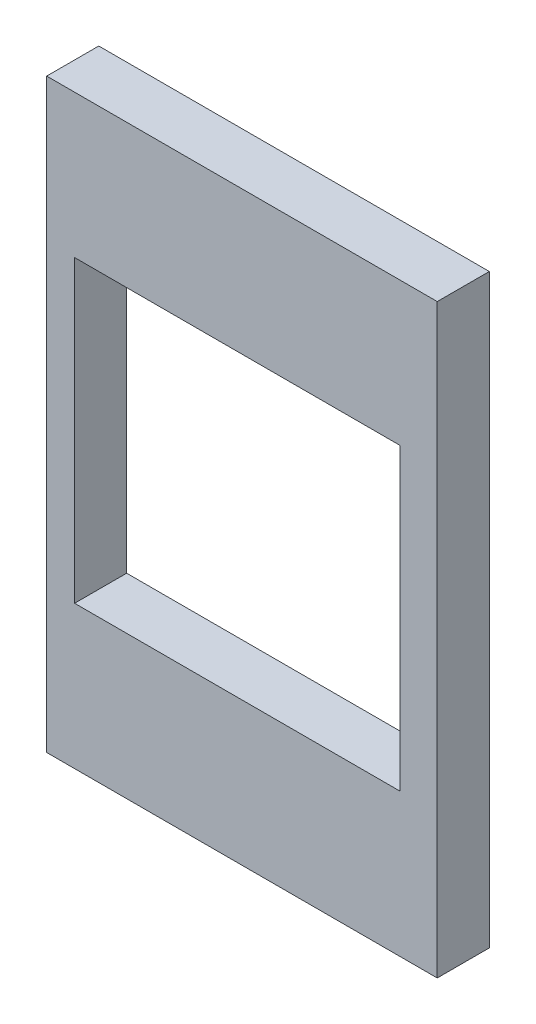
from build123d import *

# Parameters (mm, degrees)
SKETCH_1_W          = 60
SKETCH_1_H          = 90
EXTRUDE_1_DEPTH     = 8
CUT_EXTRUDE_1_REACH = 98.762


with BuildPart() as part:
    # 草图1 → 凸台-拉伸1 (new body)
    with BuildSketch(Plane.XY):
        with Locations((-55.287083442, 0)):
            Rectangle(SKETCH_1_W, SKETCH_1_H)
    extrude(amount=EXTRUDE_1_DEPTH)

    # 草图2 → 切除-拉伸1 (cut, up to next)
    with BuildSketch(Plane.XY.offset(8), mode=Mode.PRIVATE) as cut_extrude_1_sk1:
        Polygon((-81, 17), (-81, 23), (-31, 23), (-31, 17), (-31, -17), (-31, -23), (-81, -23), (-81, -17), align=None)
    cut_extrude_1_tool1 = extrude(cut_extrude_1_sk1.sketch, amount=-CUT_EXTRUDE_1_REACH, mode=Mode.PRIVATE) & part.part
    add(cut_extrude_1_tool1.solids().sort_by_distance((-56, 0, 8))[0], mode=Mode.SUBTRACT)


solid = part.part
